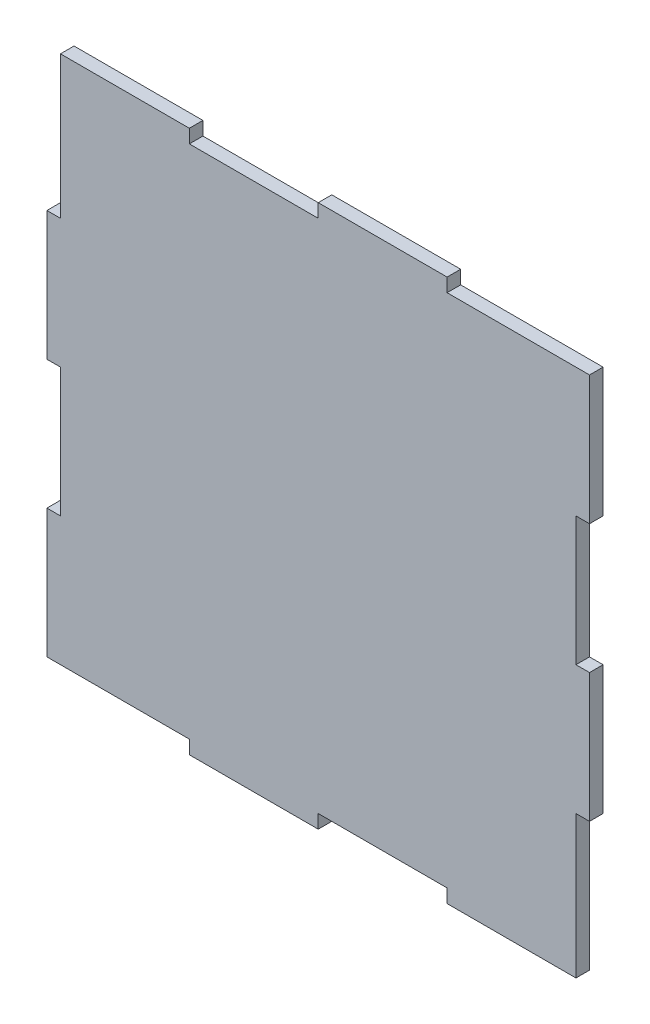
from build123d import *

# Parameters (mm, degrees)
BOSS_EXTRUDE1_DEPTH = 3.175


with BuildPart() as part:
    # Sketch1 → Boss-Extrude1 (new body)
    with BuildSketch(Plane.XY):
        Polygon((-60.325, 60.325), (-60.325, 63.5), (-30.1625, 63.5), (-30.1625, 60.325), (0, 60.325), (0, 63.5), (30.1625, 63.5), (30.1625, 60.325), (60.325, 60.325), (63.5, 60.325), (63.5, 30.1625), (60.325, 30.1625), (60.325, 0), (63.5, 0), (63.5, -30.1625), (60.325, -30.1625), (60.325, -60.325), (60.325, -63.5), (30.1625, -63.5), (30.1625, -60.325), (0, -60.325), (0, -63.5), (-30.1625, -63.5), (-30.1625, -60.325), (-60.325, -60.325), (-63.5, -60.325), (-63.5, -30.1625), (-60.325, -30.1625), (-60.325, 0), (-63.5, 0), (-63.5, 30.1625), (-60.325, 30.1625), align=None)
    extrude(amount=BOSS_EXTRUDE1_DEPTH)


solid = part.part
